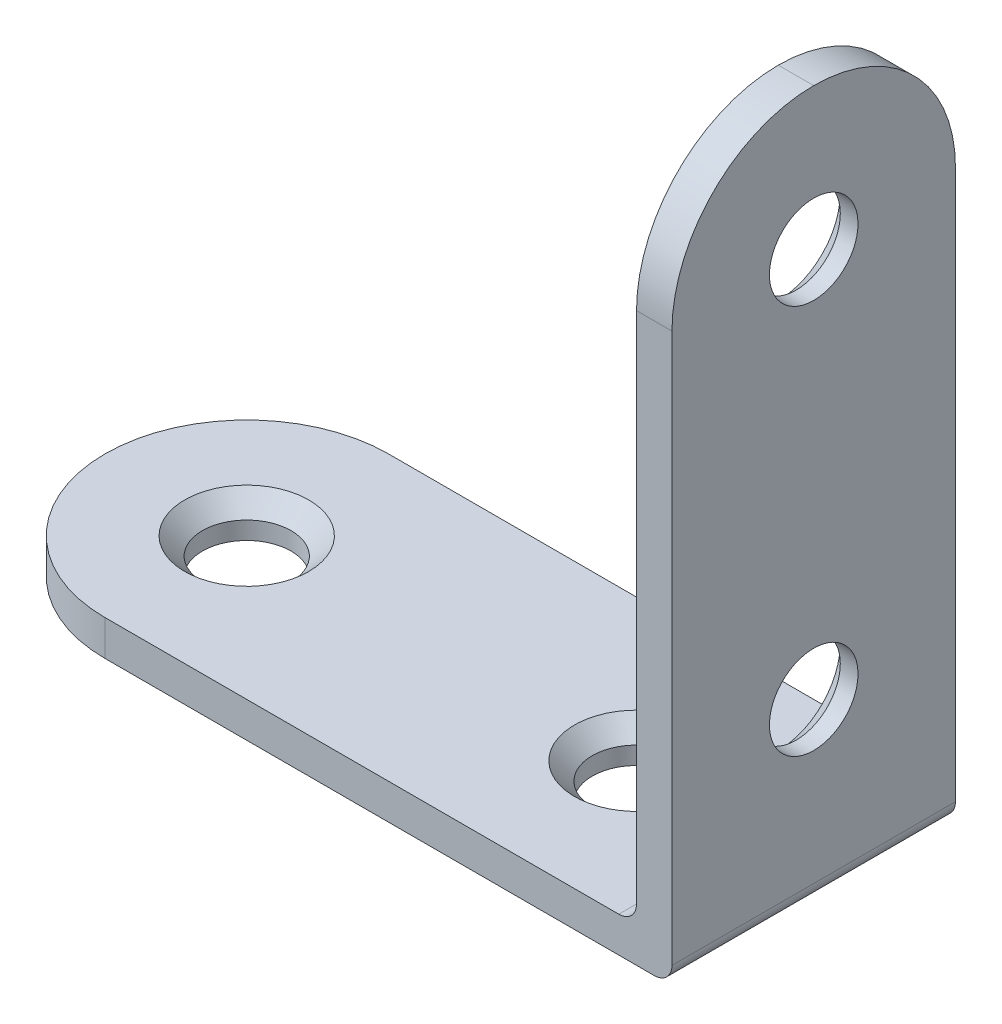
from build123d import *

# Parameters (mm, degrees)
EXTRUDE_1_DEPTH     = 16
FILLET_1_R          = 8
SKETCH_2_R          = 2.5
CUT_EXTRUDE_1_DEPTH = 16
SKETCH_3_R          = 2.5
CUT_EXTRUDE_2_DEPTH = 16
CHAMFER_1_SIZE      = 1
FILLET_2_R          = 1


with BuildPart() as part:
    # 草图1 → 凸台-拉伸1 (new body)
    with BuildSketch(Plane.XY):
        Polygon((0, 38), (0, 0), (-38, 0), (-38, -2), (2, -2), (2, 38), align=None)
    extrude(amount=EXTRUDE_1_DEPTH)

    # 圆角1
    fillet_1_edges = [part.edges().sort_by_distance(p)[0] for p in [
        (-38, -1, 0),
        (-38, -1, 16),
        (1, 38, 16),
        (1, 38, 0),
    ]]
    fillet(fillet_1_edges, radius=FILLET_1_R - 0.0001)  # a hair under: the kernel refuses the full size

    # 草图2 → 切除-拉伸1 (cut)
    with BuildSketch(Plane.ZY):
        with Locations(Location((8, 30, 0), (0, 0, 270))):
            Circle(SKETCH_2_R)
        with Locations(Location((8, 8, 0), (0, 0, 270))):
            Circle(SKETCH_2_R)
    extrude(amount=-CUT_EXTRUDE_1_DEPTH, mode=Mode.SUBTRACT)

    # 草图3 → 切除-拉伸2 (cut)
    with BuildSketch(Plane(origin=(0, 0, 0), x_dir=(1, 0, 0), z_dir=(0, 1, 0))):
        with Locations(Location((-30, -8, 0), (0, 0, 180))):
            Circle(SKETCH_3_R)
        with Locations(Location((-8, -8, 0), (0, 0, 180))):
            Circle(SKETCH_3_R)
    extrude(amount=-CUT_EXTRUDE_2_DEPTH, mode=Mode.SUBTRACT)

    # 倒角1
    chamfer_1_edges = [part.edges().sort_by_distance(p)[0] for p in [
        (0, 32.5, 8),
        (0, 10.5, 8),
        (-27.5, 0, 8),
        (-5.5, 0, 8),
    ]]
    chamfer(chamfer_1_edges, length=CHAMFER_1_SIZE)

    # 圆角2
    fillet_2_edges = [part.edges().sort_by_distance(p)[0] for p in [
        (2, -2, 8),
        (0, 0, 8),
    ]]
    fillet(fillet_2_edges, radius=FILLET_2_R)


solid = part.part
